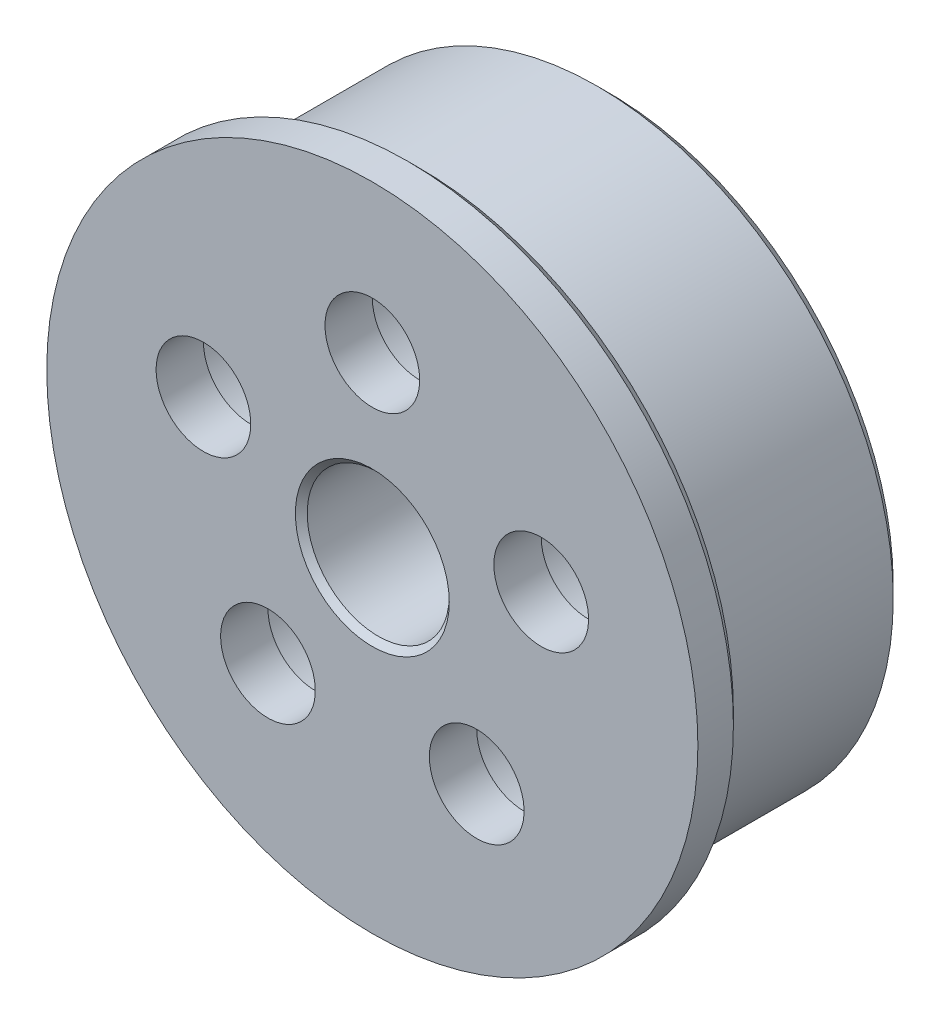
from build123d import *

# Parameters (mm, degrees)
SKETCH_1_R                   = 12.5
SKETCH_1_R_2                 = 1.5
EXTRUDE_1_DEPTH              = 10
EXTRUDE_START                = -2
SKETCH_3_R                   = 13.75
SKETCH_3_R_2                 = 12.5
EXTRUDE_3_DEPTH              = 2
SKETCH_4_R                   = 3
CUT_EXTRUDE_1_DEPTH          = 22.866069606
HOLE_WIZARD_M3_1_D           = 4
HOLE_WIZARD_M3_1_CBORE_D     = 7
HOLE_WIZARD_M3_1_CBORE_DEPTH = 8
CHAMFER_1_SIZE               = 0.5
CHAMFER_2_SIZE               = 0.25


with BuildPart() as part:
    # ｽｹｯﾁ1 → ﾎﾞｽ - 押し出し1 (new body)
    with BuildSketch(Plane.XY):
        Circle(SKETCH_1_R)
        with Locations((0, 7.5)):
            Circle(SKETCH_1_R_2, mode=Mode.SUBTRACT)
        with Locations((7.132923872, 2.317627458)):
            Circle(SKETCH_1_R_2, mode=Mode.SUBTRACT)
        with Locations((4.408389392, -6.067627458)):
            Circle(SKETCH_1_R_2, mode=Mode.SUBTRACT)
        with Locations((-4.408389392, -6.067627458)):
            Circle(SKETCH_1_R_2, mode=Mode.SUBTRACT)
        with Locations((-7.132923872, 2.317627458)):
            Circle(SKETCH_1_R_2, mode=Mode.SUBTRACT)
    extrude(amount=EXTRUDE_1_DEPTH)

    # ｽｹｯﾁ3 → ﾎﾞｽ - 押し出し3 (add)
    with BuildSketch(Plane.XY.offset(10).offset(EXTRUDE_START)):
        Circle(SKETCH_3_R)
        Circle(SKETCH_3_R_2, mode=Mode.SUBTRACT)
    extrude(amount=EXTRUDE_3_DEPTH)

    # ｽｹｯﾁ4 → ｶｯﾄ - 押し出し1 (cut, through all)
    with BuildSketch(Plane(origin=(0, 0, 0), x_dir=(-1, 0, 0), z_dir=(0, 0, -1))):
        Circle(SKETCH_4_R)
    extrude(amount=-CUT_EXTRUDE_1_DEPTH, mode=Mode.SUBTRACT)

    # M3 穴付きねじ用座ぐり穴1 (through all)
    with Locations(Plane(origin=(0, 0, 0), x_dir=(-1, 0, 0), z_dir=(0, 0, -1))):
        with Locations((0, 7.5), (7.132923872, 2.317627458), (4.408389392, -6.067627458), (-4.408389392, -6.067627458), (-7.132923872, 2.317627458)):
            CounterBoreHole(HOLE_WIZARD_M3_1_D / 2, HOLE_WIZARD_M3_1_CBORE_D / 2, HOLE_WIZARD_M3_1_CBORE_DEPTH)

    # 面取り1
    chamfer_1_edges = [part.edges().sort_by_distance(p)[0] for p in [
        (-12.5, 0, 0),
        (-13.75, 0, 8),
    ]]
    chamfer(chamfer_1_edges, length=CHAMFER_1_SIZE)

    # 面取り2
    chamfer_2_edges = [part.edges().sort_by_distance(p)[0] for p in [
        (3, 0, 0),
        (3, 0, 10),
        (7.908389392, -6.067627458, 0),
        (-0.908389392, -6.067627458, 0),
        (-3.632923872, 2.317627458, 0),
        (3.5, 7.5, 0),
        (10.632923872, 2.317627458, 0),
    ]]
    chamfer(chamfer_2_edges, length=CHAMFER_2_SIZE)


solid = part.part
